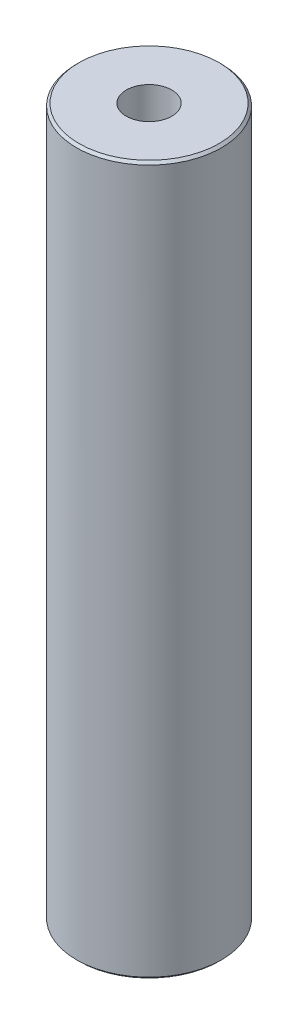
from build123d import *

# Parameters (mm, degrees)
SKETCH1_R           = 40
BOSS_EXTRUDE1_DEPTH = 390.640052341
SKETCH2_R           = 12.552751623
CUT_EXTRUDE1_DEPTH  = 395.714644386
CHAMFER1_SIZE       = 1.35483668


with BuildPart() as part:
    # Sketch1 → Boss-Extrude1 (new body)
    with BuildSketch(Plane(origin=(0, 0, 0), x_dir=(1, 0, 0), z_dir=(0, 1, 0))):
        Circle(SKETCH1_R)
    extrude(amount=BOSS_EXTRUDE1_DEPTH)

    # Sketch2 → Cut-Extrude1 (cut, through all)
    with BuildSketch(Plane(origin=(0, 0, 0), x_dir=(1, 0, 0), z_dir=(0, 1, 0))):
        Circle(SKETCH2_R)
    extrude(amount=CUT_EXTRUDE1_DEPTH, mode=Mode.SUBTRACT)

    # Chamfer1
    chamfer1_edges = [part.edges().sort_by_distance(p)[0] for p in [
        (-40, 390.640052341, 0),
        (-40, 0, 0),
    ]]
    chamfer(chamfer1_edges, length=CHAMFER1_SIZE)


solid = part.part
